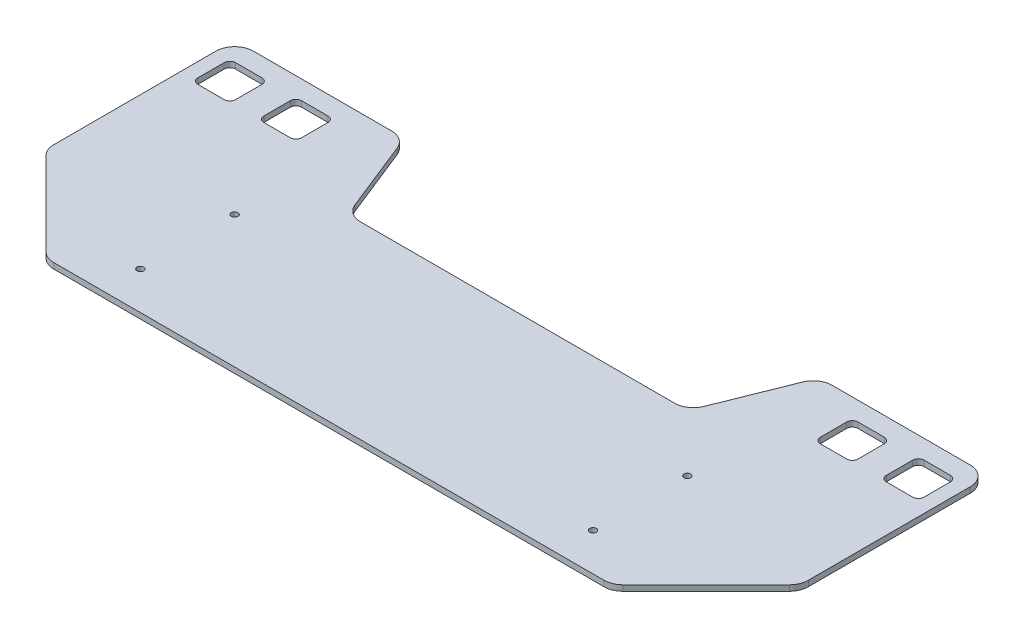
from build123d import *

# Parameters (mm, degrees)
EXTRUDE_1_DEPTH     = 3
SKETCH_3_R          = 1.75
CUT_EXTRUDE_1_DEPTH = 69
CUT_EXTRUDE_2_DEPTH = 69


with BuildPart() as part:
    # 草图1 → 凸台-拉伸1 (new body)
    with BuildSketch(Plane(origin=(0, 0, 0), x_dir=(1, 0, 0), z_dir=(0, 1, 0))):
        with BuildLine():
            Line((-197.071067812, -27.928932188), (-152.928932188, -72.071067812))
            ThreePointArc((-152.928932188, -72.071067812), (-149.6846987, -74.238795325), (-145.857864376, -75))
            Line((-145.857864376, -75), (145.857864376, -75))
            ThreePointArc((145.857864376, -75), (149.6846987, -74.238795325), (152.928932188, -72.071067812))
            Line((152.928932188, -72.071067812), (197.071067812, -27.928932188))
            ThreePointArc((197.071067812, -27.928932188), (199.238795325, -24.6846987), (200, -20.857864376))
            Line((200, -20.857864376), (200, 65))
            ThreePointArc((200, 65), (197.071067812, 72.071067812), (190, 75))
            Line((190, 75), (116.770329614, 75))
            ThreePointArc((116.770329614, 75), (111.164041521, 73.280672305), (107.485562705, 68.713906764))
            Line((107.485562705, 68.713906764), (92.514437295, 31.286093236))
            ThreePointArc((92.514437295, 31.286093236), (88.835958479, 26.719327695), (83.229670386, 25))
            Line((83.229670386, 25), (-83.229670386, 25))
            ThreePointArc((-83.229670386, 25), (-88.835958479, 26.719327695), (-92.514437295, 31.286093236))
            Line((-92.514437295, 31.286093236), (-107.485562705, 68.713906764))
            ThreePointArc((-107.485562705, 68.713906764), (-111.164041521, 73.280672305), (-116.770329614, 75))
            Line((-116.770329614, 75), (-190, 75))
            ThreePointArc((-190, 75), (-197.071067812, 72.071067812), (-200, 65))
            Line((-200, 65), (-200, -20.857864376))
            ThreePointArc((-200, -20.857864376), (-199.238795325, -24.6846987), (-197.071067812, -27.928932188))
        make_face()
    extrude(amount=EXTRUDE_1_DEPTH)

    # 草图3 → 切除-拉伸1 (cut)
    with BuildSketch(Plane.XZ):
        with Locations((-120, 55)):
            Circle(SKETCH_3_R)
        with Locations((-120, 5)):
            Circle(SKETCH_3_R)
        with Locations((120, 5)):
            Circle(SKETCH_3_R)
        with Locations((120, 55)):
            Circle(SKETCH_3_R)
    extrude(amount=-CUT_EXTRUDE_1_DEPTH, mode=Mode.SUBTRACT)

    # 草图4 → 切除-拉伸2 (cut)
    with BuildSketch(Plane(origin=(0, 3, 0), x_dir=(1, 0, 0), z_dir=(0, 1, 0))):
        with BuildLine():
            Line((-140.5, 45), (-154.5, 45))
            ThreePointArc((-154.5, 45), (-156.621320344, 45.878679656), (-157.5, 48))
            Line((-157.5, 48), (-157.5, 62))
            ThreePointArc((-157.5, 62), (-156.621320344, 64.121320344), (-154.5, 65))
            Line((-154.5, 65), (-140.5, 65))
            ThreePointArc((-140.5, 65), (-138.378679656, 64.121320344), (-137.5, 62))
            Line((-137.5, 62), (-137.5, 48))
            ThreePointArc((-137.5, 48), (-138.378679656, 45.878679656), (-140.5, 45))
        make_face()
        with BuildLine():
            Line((-175.5, 45), (-189.5, 45))
            ThreePointArc((-189.5, 45), (-191.621320344, 45.878679656), (-192.5, 48))
            Line((-192.5, 48), (-192.5, 62))
            ThreePointArc((-192.5, 62), (-191.621320344, 64.121320344), (-189.5, 65))
            Line((-189.5, 65), (-175.5, 65))
            ThreePointArc((-175.5, 65), (-173.378679656, 64.121320344), (-172.5, 62))
            Line((-172.5, 62), (-172.5, 48))
            ThreePointArc((-172.5, 48), (-173.378679656, 45.878679656), (-175.5, 45))
        make_face()
        with BuildLine():
            Line((192.5, 48), (192.5, 62))
            ThreePointArc((192.5, 62), (191.621320344, 64.121320344), (189.5, 65))
            Line((189.5, 65), (175.5, 65))
            ThreePointArc((175.5, 65), (173.378679656, 64.121320344), (172.5, 62))
            Line((172.5, 62), (172.5, 48))
            ThreePointArc((172.5, 48), (173.378679656, 45.878679656), (175.5, 45))
            Line((175.5, 45), (189.5, 45))
            ThreePointArc((189.5, 45), (191.621320344, 45.878679656), (192.5, 48))
        make_face()
        with BuildLine():
            Line((157.5, 48), (157.5, 62))
            ThreePointArc((157.5, 62), (156.621320344, 64.121320344), (154.5, 65))
            Line((154.5, 65), (140.5, 65))
            ThreePointArc((140.5, 65), (138.378679656, 64.121320344), (137.5, 62))
            Line((137.5, 62), (137.5, 48))
            ThreePointArc((137.5, 48), (138.378679656, 45.878679656), (140.5, 45))
            Line((140.5, 45), (154.5, 45))
            ThreePointArc((154.5, 45), (156.621320344, 45.878679656), (157.5, 48))
        make_face()
    extrude(amount=-CUT_EXTRUDE_2_DEPTH, mode=Mode.SUBTRACT)


solid = part.part
